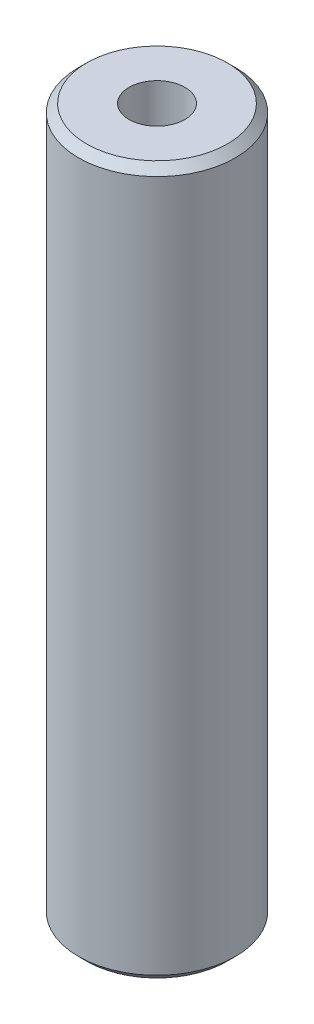
from build123d import *

# Parameters (mm, degrees)
SKETCH1_R           = 27.5
BOSS_EXTRUDE1_DEPTH = 248.415206451
SKETCH2_R           = 9.796536987
CUT_EXTRUDE1_DEPTH  = 252.441076191
CHAMFER1_SIZE       = 2.81580563


with BuildPart() as part:
    # Sketch1 → Boss-Extrude1 (new body)
    with BuildSketch(Plane(origin=(0, 0, 0), x_dir=(1, 0, 0), z_dir=(0, 1, 0))):
        Circle(SKETCH1_R)
    extrude(amount=BOSS_EXTRUDE1_DEPTH)

    # Sketch2 → Cut-Extrude1 (cut, through all)
    with BuildSketch(Plane(origin=(0, 0, 0), x_dir=(1, 0, 0), z_dir=(0, 1, 0))):
        Circle(SKETCH2_R)
    extrude(amount=CUT_EXTRUDE1_DEPTH, mode=Mode.SUBTRACT)

    # Chamfer1
    chamfer1_edges = [part.edges().sort_by_distance(p)[0] for p in [
        (-27.5, 248.415206451, 0),
        (-27.5, 0, 0),
    ]]
    chamfer(chamfer1_edges, length=CHAMFER1_SIZE)


solid = part.part
